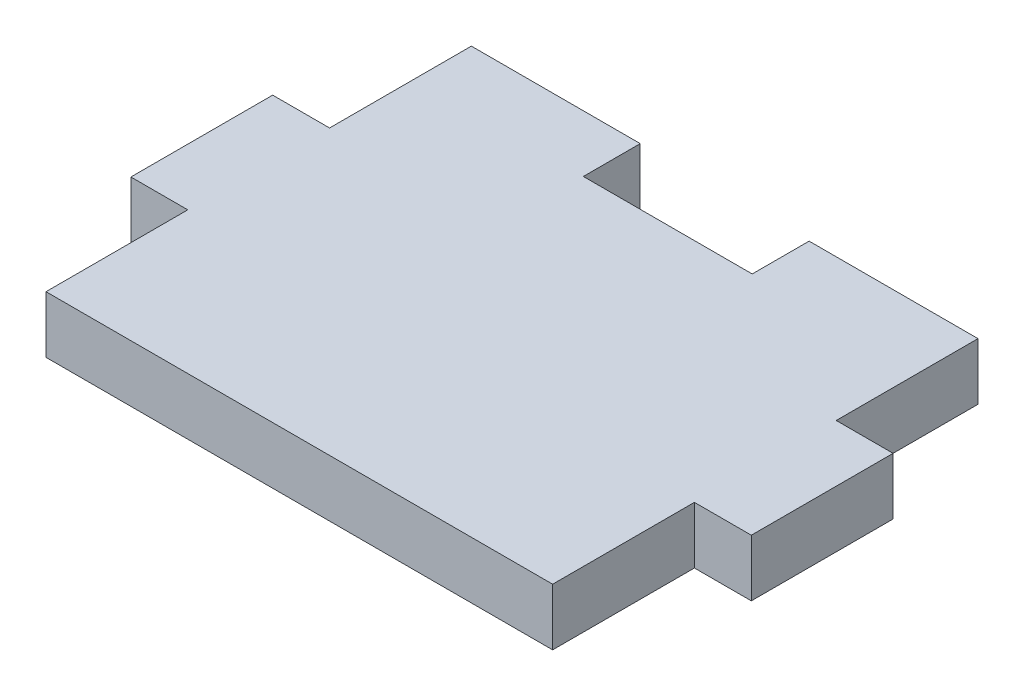
from build123d import *

# Parameters (mm, degrees)
SKETCH21_W          = 47.498
SKETCH21_H          = 39.878
BOSS_EXTRUDE1_DEPTH = 2.667
SKETCH22_W          = 5.334
SKETCH22_H          = 13.292666666
BOSS_EXTRUDE2_DEPTH = 5.334
CAVITY1_START       = -19.939
CAVITY1_OUTLINE_W   = 15.832666666
CAVITY1_OUTLINE_H   = 5.334
CAVITY1_DEPTH       = 5.334


# Read off the part's stored shape, not the designer's step: Cavity1
with BuildPart() as part:
    # Sketch21 → Boss-Extrude1 (new, symmetric)
    with BuildSketch(Plane(origin=(0, 0, 0), x_dir=(1, 0, 0), z_dir=(0, 1, 0))):
        Rectangle(SKETCH21_W, SKETCH21_H)
    extrude(amount=BOSS_EXTRUDE1_DEPTH, both=True)

    # Sketch22 → Boss-Extrude2 (add, through all)
    with BuildSketch(Plane(origin=(0, 2.667, 0), x_dir=(-1, 0, 0), z_dir=(0, 1, 0))):
        with Locations((26.416, 0)):
            Rectangle(SKETCH22_W, SKETCH22_H)
        with Locations((-26.416, 0)):
            Rectangle(SKETCH22_W, SKETCH22_H)
    extrude(amount=-BOSS_EXTRUDE2_DEPTH)

    # Cavity1 outline → Cavity1 (cut)
    with BuildSketch(Plane.XY.offset(CAVITY1_START)):
        Rectangle(CAVITY1_OUTLINE_W, CAVITY1_OUTLINE_H)
    extrude(amount=CAVITY1_DEPTH, mode=Mode.SUBTRACT)


solid = part.part
